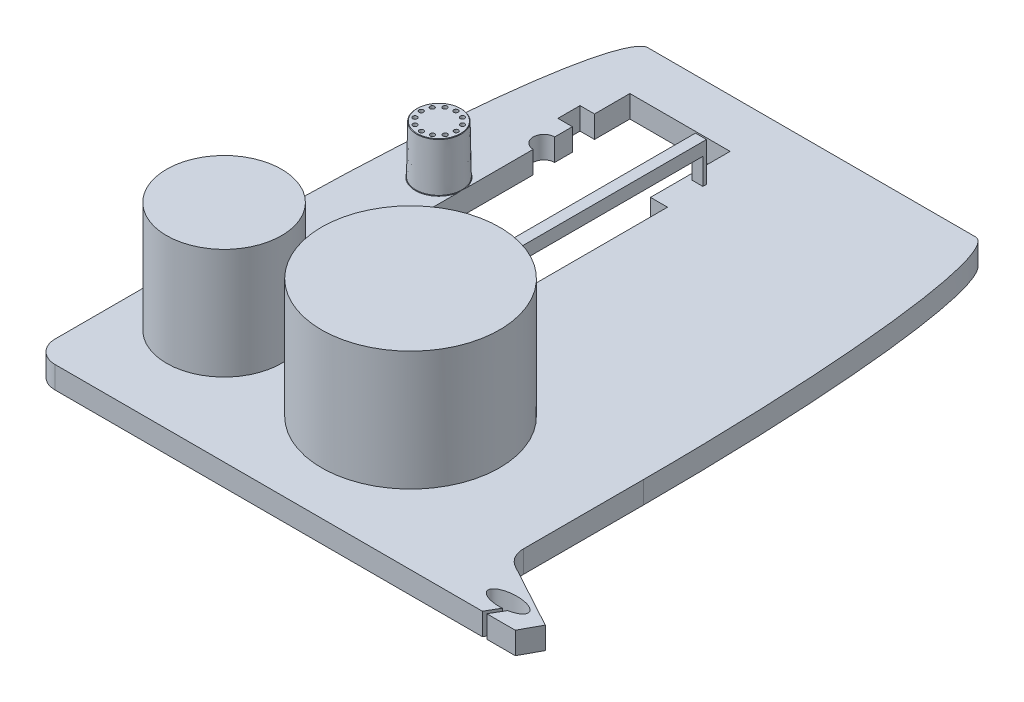
from build123d import *

# Parameters (mm, degrees)
SKETCH1_W           = 9.4
SKETCH1_H           = 12.9
BOSS_EXTRUDE1_DEPTH = 0.5
FILLET4_R           = 0.5
FILLET7_R           = 0.5
FILLET8_SIZE        = 1
FILLET8_SIZE_2      = 8.5
FILLET9_SIZE        = 8.5
FILLET9_SIZE_2      = 1
SKETCH2_RX          = 0.452766649
SKETCH2_RY          = 0.2
CUT_EXTRUDE1_DEPTH  = 0.5
CUT_EXTRUDE2_DEPTH  = 0.5
CUT_EXTRUDE3_DEPTH  = 0.5
BOSS_EXTRUDE2_DEPTH = 0.25
SKETCH6_R           = 0.5
BOSS_EXTRUDE3_DEPTH = 0.7
SKETCH7_R           = 0.5
BOSS_EXTRUDE4_DEPTH = 0.4
DRAFT1_ANGLE        = 1
SKETCH17_R          = 0.05
CUT_EXTRUDE6_DEPTH  = 0.2
CIRPATTERN1_COUNT   = 12
CHAMFER3_SIZE       = 0.01
CHAMFER3_SIZE_2     = 0.010179202
SKETCH22_R          = 1.3
BOSS_EXTRUDE6_DEPTH = 2.5
SKETCH23_R          = 0.9
BOSS_EXTRUDE8_DEPTH = 0.7
SKETCH24_R          = 2.012011857
BOSS_EXTRUDE9_DEPTH = 2.7
FILLET12_R          = 0.1


with BuildPart() as part:
    # Sketch1 → Boss-Extrude1 (new body)
    with BuildSketch(Plane(origin=(0, 0, 0), x_dir=(1, 0, 0), z_dir=(0, 1, 0))):
        Polygon((0.065621543, 7.744296826), (0.065621543, 6.358511849), (1.565621543, 6.358511849), (1.804669866, 6.797665466), align=None)
        with Locations((-4.634378457, 12.808511849)):
            Rectangle(SKETCH1_W, SKETCH1_H)
    extrude(amount=BOSS_EXTRUDE1_DEPTH)

    # Fillet4
    fillet4_edges = [part.edges().sort_by_distance(p)[0] for p in [
        (0.065621543, 0.25, -7.744296826),
    ]]
    fillet(fillet4_edges, radius=FILLET4_R)

    # Fillet7
    fillet7_edges = [part.edges().sort_by_distance(p)[0] for p in [
        (-9.334378457, 0.25, -6.358511849),
    ]]
    fillet(fillet7_edges, radius=FILLET7_R)

    # Fillet8
    # an asymmetric fillet: 8.5, 1 mm, written as the material it takes off along each edge
    with BuildSketch(Plane(origin=(0.065621543, -21.25, -19.258511849), x_dir=(-1, 0, 0), z_dir=(0, 1, 0))) as fillet8_piece_1:
        with BuildLine():
            Bezier((FILLET8_SIZE, 0), (0, 0), (0, FILLET8_SIZE_2), weights=[1, 0.707106781, 1])
            Line((0, FILLET8_SIZE_2), (0, 0))
            Line((0, 0), (FILLET8_SIZE, 0))
        make_face()
    extrude(amount=43, mode=Mode.SUBTRACT)

    # Fillet9
    # an asymmetric fillet: 8.5, 1 mm, written as the material it takes off along each edge
    with BuildSketch(Plane(origin=(-9.334378457, -21.25, -19.258511849), x_dir=(0, 0, 1), z_dir=(0, 1, 0))) as fillet9_piece_1:
        with BuildLine():
            Bezier((FILLET9_SIZE, 0), (0, 0), (0, FILLET9_SIZE_2), weights=[1, 0.707106781, 1])
            Line((0, FILLET9_SIZE_2), (0, 0))
            Line((0, 0), (FILLET9_SIZE, 0))
        make_face()
    extrude(amount=43, mode=Mode.SUBTRACT)

    # Sketch2 → Cut-Extrude1 (cut)
    with BuildSketch(Plane(origin=(0, 0.5, 0), x_dir=(1, 0, 0), z_dir=(0, 1, 0))):
        with Locations(Location((0.922326291, 6.84128542), (0, 0, 180))):
            Ellipse(SKETCH2_RX, SKETCH2_RY)
    extrude(amount=-CUT_EXTRUDE1_DEPTH, mode=Mode.SUBTRACT)

    # Sketch3 → Cut-Extrude2 (cut)
    with BuildSketch(Plane(origin=(0, 0, 0), x_dir=(1, 0, 0), z_dir=(0, 1, 0))):
        Polygon((1.096292862, 6.656637946), (0.922326291, 6.358511849), (0.822326291, 6.358511849), (0.988590825, 6.643438984), align=None)
    extrude(amount=CUT_EXTRUDE2_DEPTH, mode=Mode.SUBTRACT)

    # Sketch4 → Cut-Extrude3 (cut)
    with BuildSketch(Plane(origin=(0, 0.5, 0), x_dir=(1, 0, 0), z_dir=(0, 1, 0))):
        with BuildLine():
            Line((-7.643596283, 18.158511849), (-7.643596283, 17.358511849))
            Line((-7.643596283, 17.358511849), (-7.970654201, 17.358511849))
            Line((-7.970654201, 17.358511849), (-7.970654201, 16.858511849))
            Line((-7.970654201, 16.858511849), (-7.643596283, 16.858511849))
            Line((-7.643596283, 16.858511849), (-7.643596283, 16.458511849))
            ThreePointArc((-7.643596283, 16.458511849), (-7.885861407, 16.216246725), (-7.643596283, 15.973981601))
            Line((-7.643596283, 15.973981601), (-7.643596283, 11.873981601))
            Line((-7.643596283, 11.873981601), (-6.193596283, 11.468418687))
            Line((-6.193596283, 11.468418687), (-4.993596283, 11.468418687))
            ThreePointArc((-4.993596283, 11.468418687), (-4.775557671, 11.686457299), (-4.993596283, 11.904495911))
            Line((-4.993596283, 11.904495911), (-4.993596283, 12.570725002))
            Line((-4.993596283, 12.570725002), (-4.993596283, 16.358511849))
            Line((-4.993596283, 16.358511849), (-5.378417371, 16.358511849))
            Line((-5.378417371, 16.358511849), (-5.378417371, 18.158511849))
            Line((-5.378417371, 18.158511849), (-7.643596283, 18.158511849))
        make_face()
    extrude(amount=-CUT_EXTRUDE3_DEPTH, mode=Mode.SUBTRACT)

    # Sketch5 → Boss-Extrude2 (add)
    with BuildSketch(Plane.ZY.offset(5)):
        with BuildLine():
            Line((-17.246848227, 0.5), (-17.246848227, 1.377441322))
            Line((-17.246848227, 1.377441322), (-8.88627879, 1.377441322))
            ThreePointArc((-8.88627879, 1.377441322), (-8.742131041, 1.233293573), (-8.88627879, 1.089145824))
            Line((-8.88627879, 1.089145824), (-17.164478085, 1.089145824))
            Line((-17.164478085, 1.089145824), (-17.164478085, 0.5))
            Line((-17.164478085, 0.5), (-17.246848227, 0.5))
        make_face()
    extrude(amount=BOSS_EXTRUDE2_DEPTH)

    # Sketch6 → Boss-Extrude3 (add)
    with BuildSketch(Plane(origin=(0, 0.5, 0), x_dir=(1, 0, 0), z_dir=(0, 1, 0))):
        with Locations(Location((-8.1644663, 14.36207626, 0), (0, 0, 270))):
            Circle(SKETCH6_R)
    extrude(amount=BOSS_EXTRUDE3_DEPTH)

    # Sketch7 → Boss-Extrude4 (add)
    with BuildSketch(Plane(origin=(0, 1.2, 0), x_dir=(1, 0, 0), z_dir=(0, 1, 0))):
        with Locations(Location((-8.1644663, 14.36207626, 0), (0, 0, 270))):
            Circle(SKETCH7_R)
    extrude(amount=BOSS_EXTRUDE4_DEPTH)

    # Draft1
    draft1_faces = [part.faces().sort_by_distance(p)[0] for p in [
        (-8.1644663, 1.05, -14.86207626),
    ]]
    draft(draft1_faces, Plane(origin=(-8.1644663, 1.6, -14.36207626), x_dir=(0, 0, 1), z_dir=(0, 1, 0)), DRAFT1_ANGLE)

    # Sketch17 → Cut-Extrude6 (cut)
    with BuildSketch(Plane(origin=(0, 1.6, 0), x_dir=(1, 0, 0), z_dir=(0, 1, 0))):
        with Locations(Location((-8.16651982, 14.750544579, 0), (0, 0, 270))):
            Circle(SKETCH17_R)
    cut_extrude6 = extrude(amount=-CUT_EXTRUDE6_DEPTH, mode=Mode.SUBTRACT)

    # CirPattern1: Cut-Extrude6 ×12 about axis
    cirpattern1_axis = Axis((-8.164445557, 0, -14.358152338), (0, 1, 0))
    for i in range(1, CIRPATTERN1_COUNT):
        add(cut_extrude6.rotate(cirpattern1_axis, i * 360 / CIRPATTERN1_COUNT), mode=Mode.SUBTRACT)

    # Chamfer3
    # the kernel refuses this chamfer: 0.010179202, 0.01 mm, written as the material it adds along each edge
    with BuildSketch(Plane(origin=(-8.1644663, 0.5, -14.36207626), x_dir=(0, 0, 1), z_dir=(-1, 0, 0))) as chamfer3_piece_1_section:
        Polygon((0.519200571 + CHAMFER3_SIZE, 0), (0.519200571 - CHAMFER3_SIZE_2 * 0.0174524062842, CHAMFER3_SIZE_2 * 0.999847686386), (0.519200571, 0), align=None)
    chamfer3_piece_1 = revolve(axis=Axis((-8.1644663, 0.5, -14.36207626), (0, 1, 0)), mode=Mode.PRIVATE)
    chamfer3_piece_1 = split(chamfer3_piece_1, bisect_by=Plane(origin=(-7.643596283, 0.504689418, -14.885788598), z_dir=(-1, 0, 0)), keep=Keep.TOP, mode=Mode.PRIVATE)
    add(chamfer3_piece_1)
    # the kernel refuses this chamfer: 0.010179202, 0.01 mm, written as the material it takes off along each edge
    with BuildSketch(Plane(origin=(-8.1644663, 1.6, -14.36207626), x_dir=(0, 0, 1), z_dir=(-1, 0, 0))) as chamfer3_2_piece_1:
        Polygon((0.5 + CHAMFER3_SIZE * 0.0174524064372, -CHAMFER3_SIZE * 0.999847695156), (0.5 - CHAMFER3_SIZE_2 * 0.999999991228, 0), (0.5, 0), align=None)
    revolve(axis=Axis((-8.1644663, 1.6, -14.36207626), (0, 1, 0)), mode=Mode.SUBTRACT)

    # Sketch22 → Boss-Extrude6 (add)
    with BuildSketch(Plane(origin=(0, 0.5, 0), x_dir=(1, 0, 0), z_dir=(0, 1, 0))):
        with Locations(Location((-7.597449318, 8.940947153, 0), (0, 0, 270))):
            Circle(SKETCH22_R)
    extrude(amount=BOSS_EXTRUDE6_DEPTH)

    # Sketch23 → Boss-Extrude8 (add)
    with BuildSketch(Plane(origin=(0, 0.5, 0), x_dir=(1, 0, 0), z_dir=(0, 1, 0))):
        with Locations(Location((-3.101125203, 8.659155236, 0), (0, 0, 270))):
            Circle(SKETCH23_R)
    extrude(amount=BOSS_EXTRUDE8_DEPTH)

    # Sketch24 → Boss-Extrude9 (add)
    with BuildSketch(Plane(origin=(0, 1.2, 0), x_dir=(1, 0, 0), z_dir=(0, 1, 0))):
        with Locations(Location((-3.101125203, 8.659155236, 0), (0, 0, 160.694494452))):
            Circle(SKETCH24_R)
    extrude(amount=BOSS_EXTRUDE9_DEPTH)

    # Fillet12
    fillet12_edges = [part.edges().sort_by_distance(p)[0] for p in [
        (-7.643596283, 0.25, -11.873981601),
    ]]
    fillet(fillet12_edges, radius=FILLET12_R)


solid = part.part
